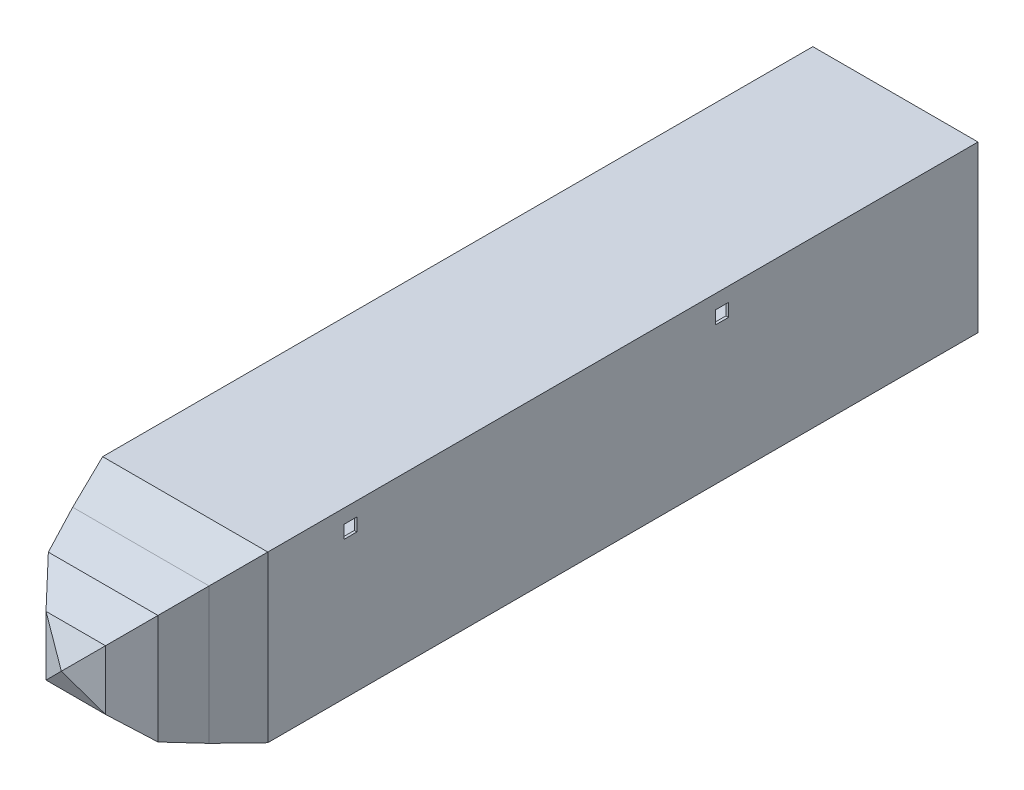
from build123d import *

# Parameters (mm, degrees)
SKETCH1_W           = 101.6
SKETCH1_H           = 101.6
BOSS_EXTRUDE1_DEPTH = 436.88
SHELL1_T            = -1.5875
SKETCH9_W           = 8.001
SKETCH9_H           = 8.001
CUT_EXTRUDE1_DEPTH  = 526.503840631


with BuildPart() as part:
    # Sketch1 → Boss-Extrude1 (new body)
    with BuildSketch(Plane.XY):
        Rectangle(SKETCH1_W, SKETCH1_H)
    extrude(amount=BOSS_EXTRUDE1_DEPTH)

    # Sketch5 → Loft2 section 0
    with BuildSketch(Plane.XY.offset(436.88)):
        with BuildLine():
            Line((50.8, -50.8), (50.8, 50.8))
            Line((50.8, 50.8), (-50.8, 50.8))
            Line((-50.8, 50.8), (-50.8, -50.8))
            Line((-50.8, -50.8), (50.8, -50.8))
        make_face()
    # Sketch3 → Loft2 section 1
    with BuildSketch(Plane.XY.offset(464.156588322)):
        with BuildLine():
            Line((-41.937305, -41.937305), (41.937305, -41.937305))
            Line((41.937305, -41.937305), (41.937305, 41.937305))
            Line((41.937305, 41.937305), (-41.937305, 41.937305))
            Line((-41.937305, 41.937305), (-41.937305, -41.937305))
        make_face()
    loft()

    # Sketch3<6> → Loft3 section 0
    with BuildSketch(Plane.XY.offset(464.156588322)):
        with BuildLine():
            Line((-41.937305, -41.937305), (41.937305, -41.937305))
            Line((41.937305, -41.937305), (41.937305, 41.937305))
            Line((41.937305, 41.937305), (-41.937305, 41.937305))
            Line((-41.937305, 41.937305), (-41.937305, -41.937305))
        make_face()
    # Sketch6 → Loft3 section 1
    with BuildSketch(Plane.XY.offset(487.359440316)):
        with BuildLine():
            Line((-33.71596, -33.71596), (33.71596, -33.71596))
            Line((33.71596, -33.71596), (33.71596, 33.71596))
            Line((33.71596, 33.71596), (-33.71596, 33.71596))
            Line((-33.71596, 33.71596), (-33.71596, -33.71596))
        make_face()
    loft()

    # Sketch6<4> → Loft4 section 0
    with BuildSketch(Plane.XY.offset(487.359440316)):
        with BuildLine():
            Line((-33.71596, -33.71596), (33.71596, -33.71596))
            Line((33.71596, -33.71596), (33.71596, 33.71596))
            Line((33.71596, 33.71596), (-33.71596, 33.71596))
            Line((-33.71596, 33.71596), (-33.71596, -33.71596))
        make_face()
    # Sketch7 → Loft4 section 1
    with BuildSketch(Plane.XY.offset(504.217299158)):
        with BuildLine():
            Line((-18.304143458, -18.304143458), (18.304143458, -18.304143458))
            Line((18.304143458, -18.304143458), (18.304143458, 18.304143458))
            Line((18.304143458, 18.304143458), (-18.304143458, 18.304143458))
            Line((-18.304143458, 18.304143458), (-18.304143458, -18.304143458))
        make_face()
    loft()

    # Sketch7<5> → Loft5 section 0
    with BuildSketch(Plane.XY.offset(504.217299158), mode=Mode.PRIVATE) as loft5_s0:
        with BuildLine():
            Line((-18.304143458, -18.304143458), (18.304143458, -18.304143458))
            Line((18.304143458, -18.304143458), (18.304143458, 18.304143458))
            Line((18.304143458, 18.304143458), (-18.304143458, 18.304143458))
            Line((-18.304143458, 18.304143458), (-18.304143458, -18.304143458))
        make_face()
    loft([Vertex(0, 0, 513.079999985), loft5_s0.sketch])

    # Shell1
    shell1_openings = [part.faces().sort_by_distance(p)[0] for p in [
        (0, 0, 0),
    ]]
    offset(amount=SHELL1_T, openings=shell1_openings, kind=Kind.INTERSECTION)

    # Sketch9 → Cut-Extrude1 (cut, through all)
    with BuildSketch(Plane(origin=(50.8, 0, 0), x_dir=(0, 0, -1), z_dir=(1, 0, 0))):
        with Locations((-386.08, 38.1)):
            Rectangle(SKETCH9_W, SKETCH9_H)
        Polygon((-161.4805, 42.1005), (-161.4805, 38.1), (-161.4805, 34.0995), (-153.4795, 34.0995), (-153.4795, 42.1005), align=None)
    extrude(amount=-CUT_EXTRUDE1_DEPTH, mode=Mode.SUBTRACT)


solid = part.part
